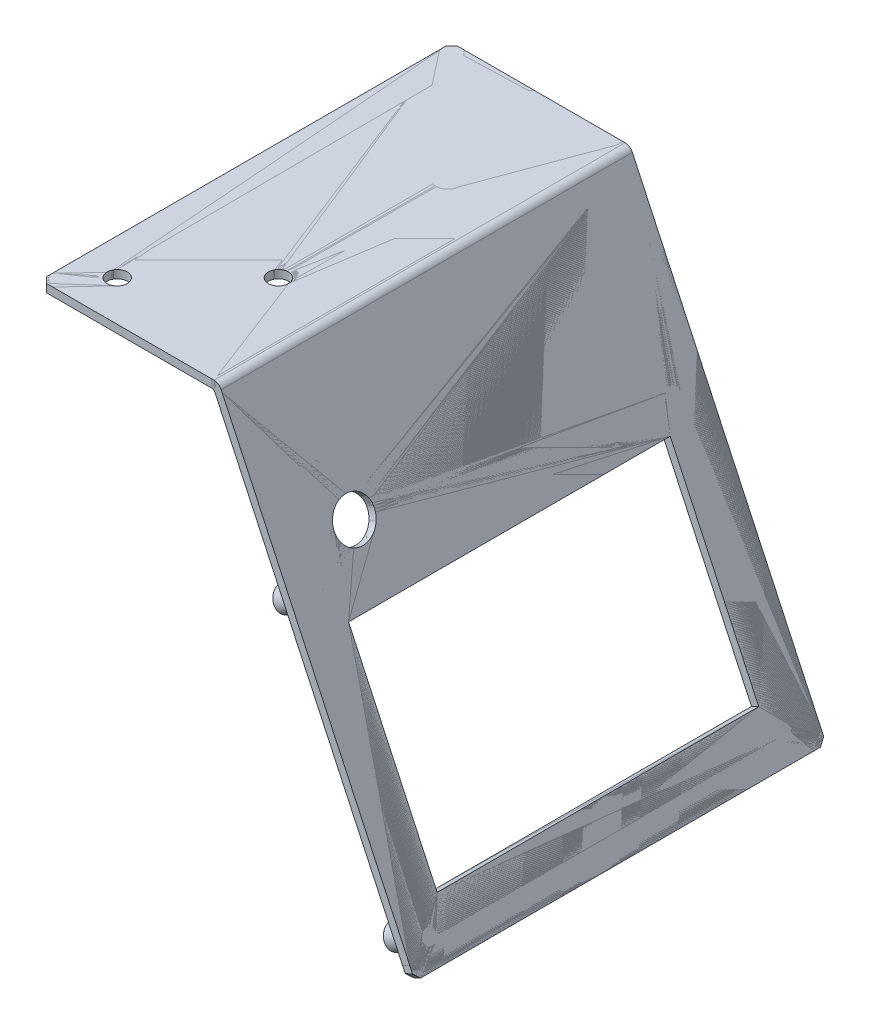
from build123d import *

# Parameters (mm, degrees)
BASE_FLANGE1_DEPTH         = 102
BASE_FLANGE1_START         = 31.125998319
BASE_FLANGE1_2_OUTLINE_R   = 3
BASE_FLANGE1_2_OUTLINE_R_2 = 1.35
BASE_FLANGE1_2_DEPTH       = 9
BASE_FLANGE1_START_2       = 38.125998319
BASE_FLANGE1_3_OUTLINE_R   = 1.35
BASE_FLANGE1_3_DEPTH       = 2
BASE_FLANGE1_4_DEPTH       = 102
BASE_FLANGE1_5_DEPTH       = 11.5
BASE_FLANGE1_START_3       = 91.3
BASE_FLANGE1_6_DEPTH       = 10.7
BASE_FLANGE1_START_4       = -2
BASE_FLANGE1_7_OUTLINE_R   = 2.8
BASE_FLANGE1_7_DEPTH       = 2
BASE_FLANGE1_START_5       = 0.638380538
BASE_FLANGE1_8_OUTLINE_R   = 5
BASE_FLANGE1_8_DEPTH       = 40.361619462
SKETCH6_R                  = 5
SKETCH6_W                  = 79.8
SKETCH6_H                  = 52
CUT_EXTRUDE1_DEPTH         = 10
SKETCH7_R                  = 2.5
CUT_EXTRUDE2_DEPTH         = 10
CUT_EXTRUDE3_DEPTH         = 10
CUT_EXTRUDE4_DEPTH         = 10
SKETCH10_R                 = 1.75
CUT_EXTRUDE5_DEPTH         = 10


with BuildPart() as part:
    # Base-Flange1: read off the stored shape, not the designer's step
    # Base-Flange1 outline → Base-Flange1 (new body)
    with BuildSketch(Plane.XY):
        with BuildLine():
            Line((43.215390021, -2.461905391), (91.062625048, -105.070632033))
            Line((91.062625048, -105.070632033), (92.875240622, -104.225395509))
            Line((92.875240622, -104.225395509), (45.028005595, -1.616668867))
            ThreePointArc((45.028005595, -1.616668867), (43.994782694, -0.438503952), (42.490343791, 0))
            Line((42.490343791, 0), (0, 0))
            Line((0, 0), (0, -2))
            Line((0, -2), (42.490343791, -2))
            ThreePointArc((42.490343791, -2), (42.920183478, -2.125286843), (43.215390021, -2.461905391))
        make_face()
    extrude(amount=BASE_FLANGE1_DEPTH)

    # Sketch6 → Cut-Extrude1 (cut)
    with BuildSketch(Plane(origin=(36.366504739, 16.95797966, 0), x_dir=(0, 0, -1), z_dir=(0.906307787036648, 0.4226182617407039, 0))):
        with Locations(Location((-83.1, -53.405591591, 0), (0, 0, 90))):
            Circle(SKETCH6_R)
        with Locations((-51.4, -95.405591591)):
            Rectangle(SKETCH6_W, SKETCH6_H)
    extrude(amount=-CUT_EXTRUDE1_DEPTH, mode=Mode.SUBTRACT)


with BuildPart() as body_2:
    # Base-Flange1 2 outline → Base-Flange1 2 (new body)
    # profile 1 of 4: a face of its own
    with BuildSketch(Plane(origin=(0, 0, 0), x_dir=(-0.422618261740704, 0.9063077870366479, 0), z_dir=(0.9063077870366479, 0.42261826174070394, 0)).offset(BASE_FLANGE1_START)):
        with Locations((-62.955591591, 8.05)):
            Circle(BASE_FLANGE1_2_OUTLINE_R)
        with Locations((-62.955591591, 8.05)):
            Circle(BASE_FLANGE1_2_OUTLINE_R_2, mode=Mode.SUBTRACT)
    # profile 2 of 4: a face of its own
    with BuildSketch(Plane(origin=(0, 0, 0), x_dir=(-0.422618261740704, 0.9063077870366479, 0), z_dir=(0.9063077870366479, 0.42261826174070394, 0)).offset(BASE_FLANGE1_START)):
        with Locations((-127.855591591, 8.05)):
            Circle(BASE_FLANGE1_2_OUTLINE_R)
        with Locations((-127.855591591, 8.05)):
            Circle(BASE_FLANGE1_2_OUTLINE_R_2, mode=Mode.SUBTRACT)
    # profile 3 of 4: a face of its own
    with BuildSketch(Plane(origin=(0, 0, 0), x_dir=(-0.422618261740704, 0.9063077870366479, 0), z_dir=(0.9063077870366479, 0.42261826174070394, 0)).offset(BASE_FLANGE1_START)):
        with Locations((-127.855591591, 95.95)):
            Circle(BASE_FLANGE1_2_OUTLINE_R)
        with Locations((-127.855591591, 95.95)):
            Circle(BASE_FLANGE1_2_OUTLINE_R_2, mode=Mode.SUBTRACT)
    # profile 4 of 4: a face of its own
    with BuildSketch(Plane(origin=(0, 0, 0), x_dir=(-0.422618261740704, 0.9063077870366479, 0), z_dir=(0.9063077870366479, 0.42261826174070394, 0)).offset(BASE_FLANGE1_START)):
        with Locations((-62.955591591, 95.95)):
            Circle(BASE_FLANGE1_2_OUTLINE_R)
        with Locations((-62.955591591, 95.95)):
            Circle(BASE_FLANGE1_2_OUTLINE_R_2, mode=Mode.SUBTRACT)
    extrude(amount=BASE_FLANGE1_2_DEPTH)

    # Base-Flange1 3 outline → Base-Flange1 3 (add)
    with BuildSketch(Plane(origin=(0, 0, 0), x_dir=(-0.422618261740704, 0.9063077870366479, 0), z_dir=(0.9063077870366479, 0.42261826174070394, 0)).offset(BASE_FLANGE1_START_2)):
        with Locations((-62.955591591, 8.05)):
            Circle(BASE_FLANGE1_3_OUTLINE_R)
        with Locations((-127.855591591, 8.05)):
            Circle(BASE_FLANGE1_3_OUTLINE_R)
        with Locations((-127.855591591, 95.95)):
            Circle(BASE_FLANGE1_3_OUTLINE_R)
        with Locations((-62.955591591, 95.95)):
            Circle(BASE_FLANGE1_3_OUTLINE_R)
    extrude(amount=BASE_FLANGE1_3_DEPTH)

    # Base-Flange1 4 outline → Base-Flange1 4 (add)
    with BuildSketch(Plane.XY):
        Polygon((85.862109249, -93.918089912), (91.062625048, -105.070632033), (92.875240622, -104.225395509), (87.674724823, -93.072853389), align=None)
        with BuildLine():
            Line((43, -2), (63.885959638, -46.790084986))
            Line((63.885959638, -46.790084986), (65.698575212, -45.944848463))
            Line((65.698575212, -45.944848463), (44.812615574, -1.154763477))
            ThreePointArc((44.812615574, -1.154763477), (44.074599217, -0.313217108), (43, 0))
            Line((43, 0), (0, 0))
            Line((0, 0), (0, -2))
            Line((0, -2), (43, -2))
        make_face()
    extrude(amount=BASE_FLANGE1_4_DEPTH)

    # Base-Flange1 5 outline → Base-Flange1 5 (add)
    with BuildSketch(Plane.XY):
        Polygon((63.885959638, -46.790084986), (85.862109249, -93.918089912), (87.674724823, -93.072853389), (65.698575213, -45.944848463), align=None)
    extrude(amount=BASE_FLANGE1_5_DEPTH)

    # Base-Flange1 6 outline → Base-Flange1 6 (add)
    with BuildSketch(Plane.XY.offset(BASE_FLANGE1_START_3)):
        Polygon((63.885959638, -46.790084986), (85.862109249, -93.918089912), (87.674724823, -93.072853389), (65.698575213, -45.944848463), align=None)
    extrude(amount=BASE_FLANGE1_6_DEPTH)

    # Base-Flange1 7 outline → Base-Flange1 7 (cut)
    with BuildSketch(Plane(origin=(0, 0, 0), x_dir=(1, 0, 0), z_dir=(0, 1, 0)).offset(BASE_FLANGE1_START_4)):
        with Locations((29, -30)):
            Circle(BASE_FLANGE1_7_OUTLINE_R)
        with Locations((9, -10)):
            Circle(BASE_FLANGE1_7_OUTLINE_R)
        with BuildLine():
            ThreePointArc((3, -102), (0.878679656, -101.121320344), (0, -99))
            Line((0, -99), (0, -102))
            Line((0, -102), (3, -102))
        make_face()
        with BuildLine():
            ThreePointArc((0, -3), (0.878679656, -0.878679656), (3, 0))
            Line((3, 0), (0, 0))
            Line((0, 0), (0, -3))
        make_face()
    extrude(amount=BASE_FLANGE1_7_DEPTH, mode=Mode.SUBTRACT)

    # Base-Flange1 8 outline → Base-Flange1 8 (cut)
    with BuildSketch(Plane(origin=(0, 0, 0), x_dir=(-0.422618261740704, 0.9063077870366479, 0), z_dir=(0.9063077870366479, 0.42261826174070394, 0)).offset(BASE_FLANGE1_START_5)):
        with Locations((-53.405591591, 83.1)):
            Circle(BASE_FLANGE1_8_OUTLINE_R)
        with BuildLine():
            Line((-133.711060308, 0), (-130.711060307, 0))
            ThreePointArc((-130.711060307, 0), (-132.832380651, 0.878679656), (-133.711060307, 3))
            Line((-133.711060307, 3), (-133.711060308, 0))
        make_face()
        with BuildLine():
            Line((-133.711060308, 102), (-133.711060307, 99))
            ThreePointArc((-133.711060307, 99), (-132.832380651, 101.121320344), (-130.711060307, 102))
            Line((-130.711060307, 102), (-133.711060308, 102))
        make_face()
    extrude(amount=BASE_FLANGE1_8_DEPTH, mode=Mode.SUBTRACT)


with BuildPart() as cut_extrude2_tool:
    # Sketch7 → Cut-Extrude2 (new body)
    with BuildSketch(Plane(origin=(0, 0, 0), x_dir=(1, 0, 0), z_dir=(0, 1, 0))):
        with Locations(Location((9, -92, 0), (0, 0, 270))):
            Circle(SKETCH7_R)
        with Locations(Location((29, -72, 0), (0, 0, 270))):
            Circle(SKETCH7_R)
    extrude(amount=-CUT_EXTRUDE2_DEPTH)


with BuildPart() as part_1:
    add(part.part)

    # Cut-Extrude2: cut by cut_extrude2_tool
    add(cut_extrude2_tool.part, mode=Mode.SUBTRACT)

    # Sketch8 → Cut-Extrude3 (cut)
    with BuildSketch(Plane(origin=(36.366504739, 16.95797966, 0), x_dir=(0, 0, -1), z_dir=(0.906307787036648, 0.4226182617407039, 0))):
        Polygon((-102, -133.711060307), (-102, -132.296846745), (-100.585786438, -133.711060307), align=None)
        Polygon((-1.414213562, -133.711060307), (0, -133.711060307), (0, -132.296846745), align=None)
    extrude(amount=-CUT_EXTRUDE3_DEPTH, mode=Mode.SUBTRACT)

    # Sketch9 → Cut-Extrude4 (cut)
    with BuildSketch(Plane(origin=(0, 0, 0), x_dir=(1, 0, 0), z_dir=(0, 1, 0))):
        Polygon((0, 0), (1.414213562, 0), (0, -1.414213562), align=None)
        Polygon((0, -100.585786438), (0, -102), (1.414213562, -102), align=None)
    extrude(amount=-CUT_EXTRUDE4_DEPTH, mode=Mode.SUBTRACT)

    # Sketch10 → Cut-Extrude5 (cut)
    with BuildSketch(Plane(origin=(36.366504739, 16.95797966, 0), x_dir=(0, 0, -1), z_dir=(0.906307787036648, 0.4226182617407039, 0))):
        with Locations(Location((-95.95, -62.955591591, 0), (0, 0, 90))):
            Circle(SKETCH10_R)
        with Locations(Location((-8.05, -62.955591591, 0), (0, 0, 90))):
            Circle(SKETCH10_R)
        with Locations(Location((-95.95, -127.855591591, 0), (0, 0, 90))):
            Circle(SKETCH10_R)
        with Locations(Location((-8.05, -127.855591591, 0), (0, 0, 90))):
            Circle(SKETCH10_R)
    extrude(amount=-CUT_EXTRUDE5_DEPTH, mode=Mode.SUBTRACT)


with BuildPart() as body_2_1:
    add(body_2.part)

    # Cut-Extrude2: cut by cut_extrude2_tool
    add(cut_extrude2_tool.part, mode=Mode.SUBTRACT)


solid = Compound([part_1.part, body_2_1.part])
